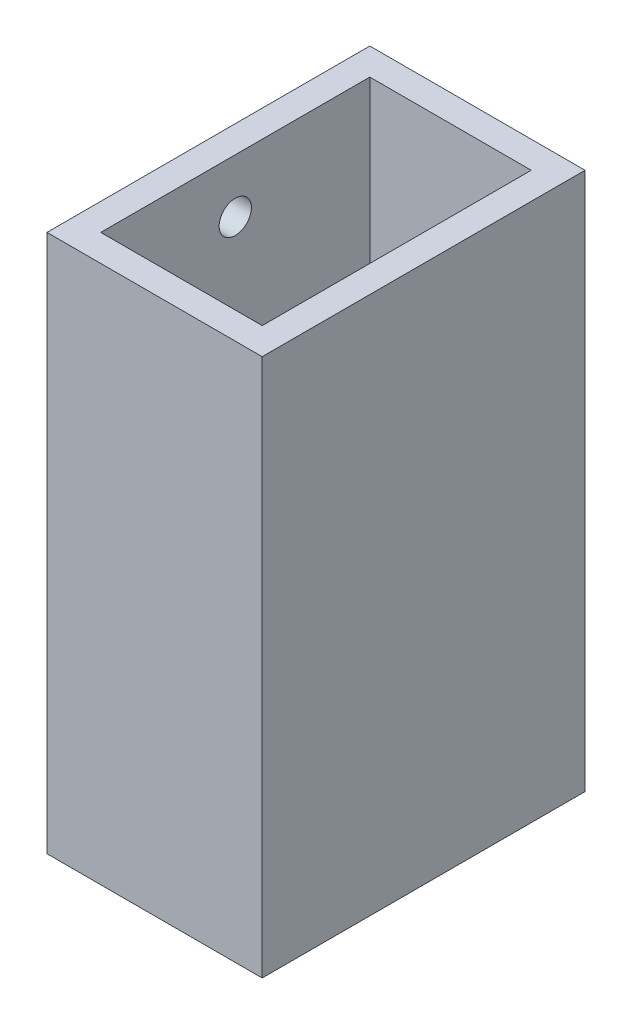
from build123d import *

# Parameters (mm, degrees)
SKETCH2_W           = 40
SKETCH2_H           = 60
BOSS_EXTRUDE1_DEPTH = 100
SHELL1_T            = -5
SKETCH3_R           = 3
CUT_EXTRUDE1_DEPTH  = 10


with BuildPart() as part:
    # Sketch2 → Boss-Extrude1 (new body)
    with BuildSketch(Plane(origin=(0, 0, 0), x_dir=(1, 0, 0), z_dir=(0, 1, 0))):
        with Locations((-20, -30)):
            Rectangle(SKETCH2_W, SKETCH2_H)
    extrude(amount=BOSS_EXTRUDE1_DEPTH)

    # Shell1
    shell1_openings = [part.faces().sort_by_distance(p)[0] for p in [
        (-20, 0, 30),
        (-20, 100, 30),
    ]]
    offset(amount=SHELL1_T, openings=shell1_openings, kind=Kind.INTERSECTION)

    # Sketch3 → Cut-Extrude1 (cut)
    with BuildSketch(Plane.ZY.offset(40)):
        with Locations((30, 90)):
            Circle(SKETCH3_R)
    extrude(amount=-CUT_EXTRUDE1_DEPTH, mode=Mode.SUBTRACT)


solid = part.part
